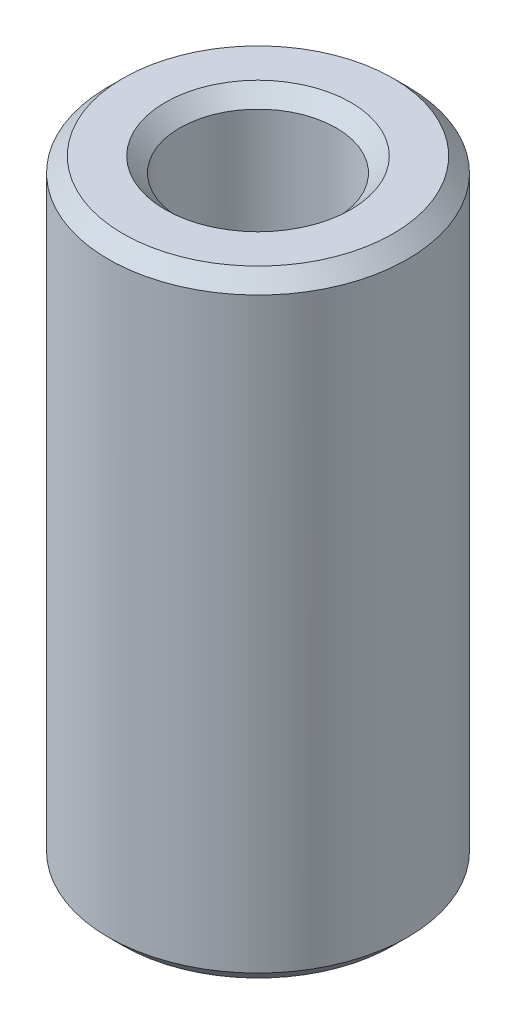
from build123d import *

# Parameters (mm, degrees)
SKETCH1_R           = 27.5
BOSS_EXTRUDE1_DEPTH = 113.377159382
SKETCH2_R           = 14.372309073
CUT_EXTRUDE1_DEPTH  = 120.861921683
CHAMFER1_SIZE       = 2.701252585


with BuildPart() as part:
    # Sketch1 → Boss-Extrude1 (new body)
    with BuildSketch(Plane(origin=(0, 0, 0), x_dir=(1, 0, 0), z_dir=(0, 1, 0))):
        Circle(SKETCH1_R)
    extrude(amount=BOSS_EXTRUDE1_DEPTH)

    # Sketch2 → Cut-Extrude1 (cut, through all)
    with BuildSketch(Plane(origin=(0, 0, 0), x_dir=(1, 0, 0), z_dir=(0, 1, 0))):
        Circle(SKETCH2_R)
    extrude(amount=CUT_EXTRUDE1_DEPTH, mode=Mode.SUBTRACT)

    # Chamfer1
    chamfer1_edges = [part.edges().sort_by_distance(p)[0] for p in [
        (-14.372309073, 113.377159382, 0),
        (-14.372309073, 0, 0),
        (-27.5, 0, 0),
        (-27.5, 113.377159382, 0),
    ]]
    chamfer(chamfer1_edges, length=CHAMFER1_SIZE)


solid = part.part
